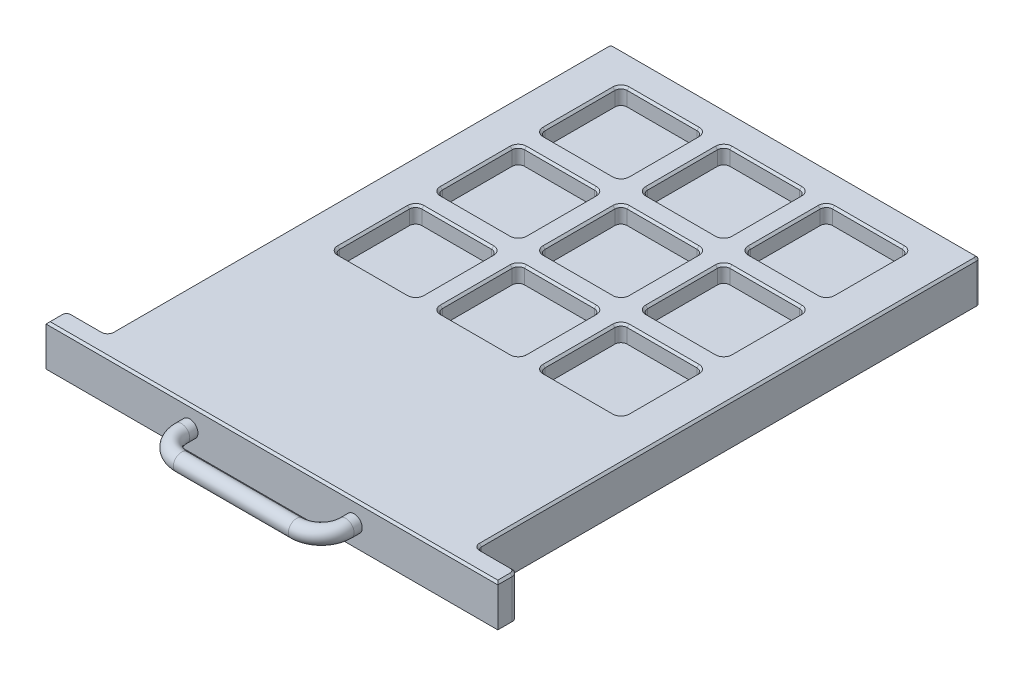
from build123d import *

# Parameters (mm, degrees)
EXTRUDE_1_DEPTH             = 20
CUT_EXTRUDE_3_DEPTH         = 8
PATTERN_LINEAR_3_COUNT      = 3
PATTERN_LINEAR_3_PITCH      = 50
PATTERN_LINEAR_3_COUNT_DIR2 = 3
PATTERN_LINEAR_3_PITCH_DIR2 = 50
CHAMFER_3_SIZE              = 1
SKETCH_5_R                  = 4


with BuildPart() as part:
    # 草图1 → 凸台-拉伸1 (new body)
    with BuildSketch(Plane(origin=(0, 0, 0), x_dir=(1, 0, 0), z_dir=(0, 1, 0))):
        with BuildLine():
            Line((-88, 255), (88, 255))
            ThreePointArc((88, 255), (89.414213562, 254.414213562), (90, 253))
            Line((90, 253), (90, 12))
            ThreePointArc((90, 12), (90.585786438, 10.585786438), (92, 10))
            Line((92, 10), (107, 10))
            ThreePointArc((107, 10), (109.121320344, 9.121320344), (110, 7))
            Line((110, 7), (110, 0))
            Line((110, 0), (-110, 0))
            Line((-110, 0), (-110, 7))
            ThreePointArc((-110, 7), (-109.121320344, 9.121320344), (-107, 10))
            Line((-107, 10), (-92, 10))
            ThreePointArc((-92, 10), (-90.585786438, 10.585786438), (-90, 12))
            Line((-90, 12), (-90, 253))
            ThreePointArc((-90, 253), (-89.414213562, 254.414213562), (-88, 255))
        make_face()
    extrude(amount=EXTRUDE_1_DEPTH)

    # 草图3 → 切除-拉伸3 (cut)
    with BuildSketch(Plane(origin=(0, 20, 0), x_dir=(1, 0, 0), z_dir=(0, 1, 0))):
        with BuildLine():
            Line((-67, 240), (-33, 240))
            ThreePointArc((-33, 240), (-30.878679656, 239.121320344), (-30, 237))
            Line((-30, 237), (-30, 203))
            ThreePointArc((-30, 203), (-30.878679656, 200.878679656), (-33, 200))
            Line((-33, 200), (-67, 200))
            ThreePointArc((-67, 200), (-69.121320344, 200.878679656), (-70, 203))
            Line((-70, 203), (-70, 237))
            ThreePointArc((-70, 237), (-69.121320344, 239.121320344), (-67, 240))
        make_face()
    cut_extrude_3 = extrude(amount=-CUT_EXTRUDE_3_DEPTH, mode=Mode.SUBTRACT)

    # 阵列(线性)3: Cut-Extrude 3 3 × 3
    with Locations(*[(i * PATTERN_LINEAR_3_PITCH, 0, j * PATTERN_LINEAR_3_PITCH_DIR2) for i in range(PATTERN_LINEAR_3_COUNT) for j in range(PATTERN_LINEAR_3_COUNT_DIR2) if (i, j) != (0, 0)]):
        add(cut_extrude_3, mode=Mode.SUBTRACT)

    # 倒角3
    chamfer_3_edges = [part.edges().sort_by_distance(p)[0] for p in [
        (70, 20, -120),
        (69.121320344, 20, -139.121320344),
        (50, 20, -140),
        (30.878679656, 20, -139.121320344),
        (30, 20, -120),
        (30.878679656, 20, -100.878679656),
        (50, 20, -100),
        (69.121320344, 20, -100.878679656),
        (20, 20, -120),
        (19.121320344, 20, -139.121320344),
        (0, 20, -140),
        (-19.121320344, 20, -139.121320344),
        (-20, 20, -120),
        (-19.121320344, 20, -100.878679656),
        (0, 20, -100),
        (19.121320344, 20, -100.878679656),
        (-30, 20, -120),
        (-30.878679656, 20, -139.121320344),
        (-50, 20, -140),
        (-69.121320344, 20, -139.121320344),
        (-70, 20, -120),
        (-69.121320344, 20, -100.878679656),
        (-50, 20, -100),
        (-30.878679656, 20, -100.878679656),
        (70, 20, -170),
        (69.121320344, 20, -189.121320344),
        (50, 20, -190),
        (30.878679656, 20, -189.121320344),
        (30, 20, -170),
        (30.878679656, 20, -150.878679656),
        (50, 20, -150),
        (69.121320344, 20, -150.878679656),
        (20, 20, -170),
        (19.121320344, 20, -189.121320344),
        (0, 20, -190),
        (-19.121320344, 20, -189.121320344),
        (-20, 20, -170),
        (-19.121320344, 20, -150.878679656),
        (0, 20, -150),
        (19.121320344, 20, -150.878679656),
        (-30, 20, -170),
        (-30.878679656, 20, -189.121320344),
        (-50, 20, -190),
        (-69.121320344, 20, -189.121320344),
        (-70, 20, -170),
        (-69.121320344, 20, -150.878679656),
        (-50, 20, -150),
        (-30.878679656, 20, -150.878679656),
        (70, 20, -220),
        (69.121320344, 20, -239.121320344),
        (50, 20, -240),
        (30.878679656, 20, -239.121320344),
        (30, 20, -220),
        (30.878679656, 20, -200.878679656),
        (50, 20, -200),
        (69.121320344, 20, -200.878679656),
        (99.5, 20, -10),
        (109.121320344, 20, -9.121320344),
        (110, 20, -3.5),
        (0, 20, 0),
        (-110, 20, -3.5),
        (-109.121320344, 20, -9.121320344),
        (-99.5, 20, -10),
        (-90.585786438, 20, -10.585786438),
        (-90, 20, -132.5),
        (-89.414213562, 20, -254.414213562),
        (89.414213562, 20, -254.414213562),
        (90, 20, -132.5),
        (90.585786438, 20, -10.585786438),
        (-30.878679656, 20, -239.121320344),
        (-50, 20, -240),
        (-69.121320344, 20, -239.121320344),
        (-70, 20, -220),
        (-69.121320344, 20, -200.878679656),
        (-50, 20, -200),
        (-30.878679656, 20, -200.878679656),
        (-30, 20, -220),
        (19.121320344, 20, -239.121320344),
        (0, 20, -240),
        (-19.121320344, 20, -239.121320344),
        (-20, 20, -220),
        (-19.121320344, 20, -200.878679656),
        (0, 20, -200),
        (19.121320344, 20, -200.878679656),
        (20, 20, -220),
        (0, 20, -255),
    ]]
    chamfer(chamfer_3_edges, length=CHAMFER_3_SIZE)

    # 扫描1: sweep along a path in 草图4
    with BuildLine(Plane(origin=(0, 10, 0), x_dir=(-1, 0, 0), z_dir=(0, -1, 0))) as sweep_1_path:
        Line((-40, 0), (-40, -4))
        ThreePointArc((-40, -4), (-36.485281374, -12.485281374), (-28, -16))
        Line((-28, -16), (28, -16))
        ThreePointArc((28, -16), (36.485281374, -12.485281374), (40, -4))
        Line((40, -4), (40, 0))
    # 草图5 → 扫描1 (sweep)
    with BuildSketch(Plane.XY):
        with Locations((-40, 10)):
            Circle(SKETCH_5_R)
    sweep(path=sweep_1_path.line)


solid = part.part
